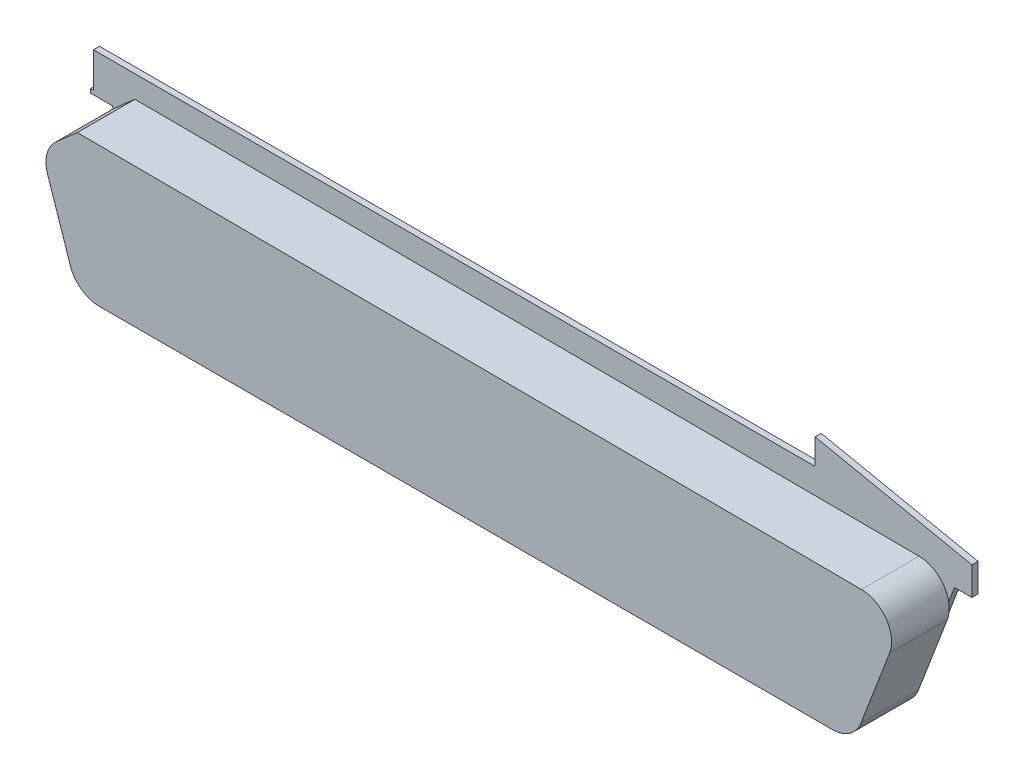
from build123d import *

# Parameters (mm, degrees)
BOSS_EXTRUDE1_DEPTH = 10
BOSS_EXTRUDE2_DEPTH = 95
CUT_EXTRUDE1_DEPTH  = 95


with BuildPart() as part:
    # Sketch1 → Boss-Extrude1 (new body)
    with BuildSketch(Plane.XY):
        Polygon((-736.648701218, 88.883015108), (453.41882074, 88.883015108), (453.41882074, 173.482456742), (711.95348608, 124.467176144), (711.95348608, 30.993499664), (683.208977835, 30.993499664), (659.264020192, -32.002513419), (641.952563774, -32.002513419), (632.634396759, -56.517377047), (353.590702351, -101.164368152), (-642.977873177, -101.164368152), (-674.853268885, -32.002513419), (-679.263572152, -32.002513419), (-705.332399808, 24.560501137), (-741.648701218, 24.560501137), (-741.648701218, 30.993499664), (-736.648701218, 30.993499664), align=None)
    extrude(amount=BOSS_EXTRUDE1_DEPTH)

    # Sketch3 → Boss-Extrude2 (add)
    with BuildSketch(Plane.XY.offset(10)):
        with BuildLine():
            Line((671.16745025, -21.467434874), (623.636749726, -145.510970388))
            ThreePointArc((623.636749726, -145.510970388), (605.279654008, -168.818344335), (576.947013652, -177.620510771))
            Line((576.947013652, -177.620510771), (-632.243121152, -177.620510771))
            ThreePointArc((-632.243121152, -177.620510771), (-661.43963365, -168.210702417), (-679.646802661, -143.523057087))
            Line((-679.646802661, -143.523057087), (-717.221496319, -31.517169759))
            ThreePointArc((-717.221496319, -31.517169759), (-718.097454162, -2.611684387), (-702.82301545, 21.944087008))
            Line((-702.82301545, 21.944087008), (-668.208105935, 52.362384654))
            Line((-668.208105935, 52.362384654), (624.707420787, 46.422497089))
            ThreePointArc((624.707420787, 46.422497089), (665.740521169, 24.660955953), (671.16745025, -21.467434874))
        make_face()
    extrude(amount=BOSS_EXTRUDE2_DEPTH)

    # Sketch4 → Cut-Extrude1 (cut)
    with BuildSketch(Plane.XY.offset(10)):
        Polygon((453.41882074, 131.182735925), (711.95348608, 77.730337904), (711.95348608, 124.467176144), (453.41882074, 173.482456742), align=None)
    extrude(amount=-CUT_EXTRUDE1_DEPTH, mode=Mode.SUBTRACT)


solid = part.part
